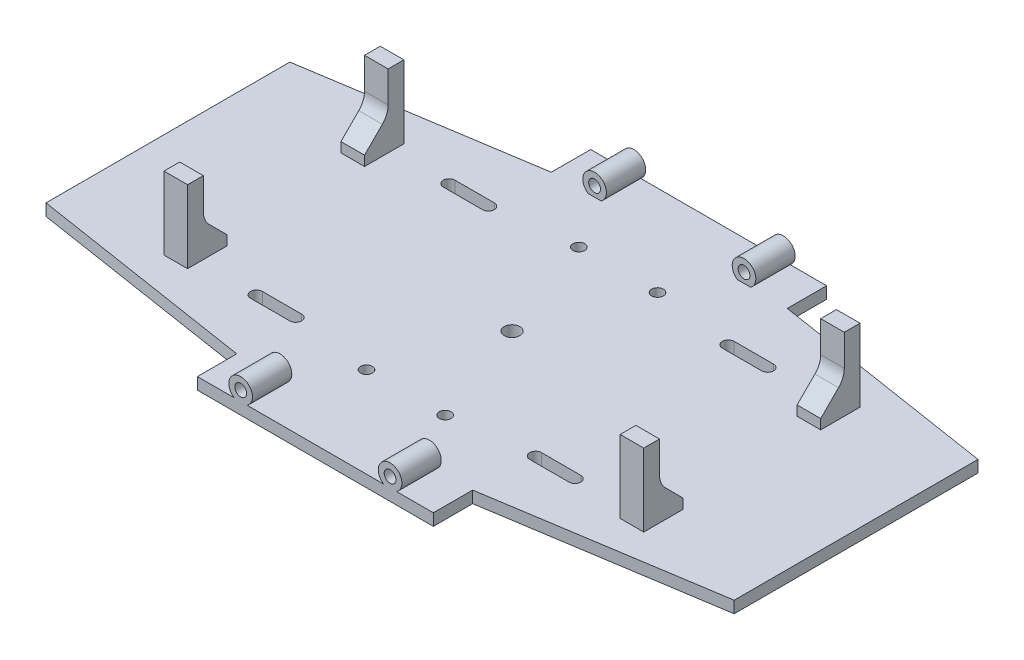
from build123d import *

# Parameters (mm, degrees)
BOSS_EXTRUDE1_DEPTH = 3
SKETCH2_R           = 3
SKETCH2_R_2         = 1.5
BOSS_EXTRUDE2_DEPTH = 10
SKETCH3_R           = 2
SKETCH3_R_2         = 1.5
CUT_EXTRUDE1_DEPTH  = 101.928192295
SKETCH4_W           = 6
SKETCH4_H           = 10
BOSS_EXTRUDE3_DEPTH = 18.5
SKETCH5_W           = 6
SKETCH5_H           = 10
CUT_EXTRUDE2_DEPTH  = 159.159729388
CHAMFER1_SIZE       = 6
FILLET1_START       = -61
FILLET1_DEPTH       = 6
FILLET1_START_2     = 55
FILLET1_2_DEPTH     = 6


with BuildPart() as part:
    # Sketch1 → Boss-Extrude1 (new body)
    with BuildSketch(Plane(origin=(0, 0, 0), x_dir=(1, 0, 0), z_dir=(0, 1, 0))):
        Polygon((30, -50), (30, -40), (30, 40), (30, 50), (-30, 50), (-30, 40), (-30, -40), (-30, -50), align=None)
        Polygon((-87.5, -31), (-30, -40), (-30, 40), (-87.5, 31), align=None)
        Polygon((30, 40), (30, -40), (87.5, -31), (87.5, 31), align=None)
    extrude(amount=BOSS_EXTRUDE1_DEPTH)

    # Sketch2 → Boss-Extrude2 (add)
    # profile 1 of 2: a face of its own
    with BuildSketch(Plane.XY.offset(50)):
        with Locations((19, 5.5)):
            Circle(SKETCH2_R)
        with Locations((19, 5.5)):
            Circle(SKETCH2_R_2, mode=Mode.SUBTRACT)
    # profile 2 of 2: a face of its own
    with BuildSketch(Plane.XY.offset(50)):
        with Locations((-19, 5.5)):
            Circle(SKETCH2_R)
        with Locations(Location((-19, 5.5, 0), (0, 0, 180))):
            Circle(SKETCH2_R_2, mode=Mode.SUBTRACT)
    boss_extrude2 = extrude(amount=-BOSS_EXTRUDE2_DEPTH)

    # Mirror1: Boss-Extrude2 across plane
    add(boss_extrude2.mirror(Plane.XY))

    # Sketch3 → Cut-Extrude1 (cut, through all)
    with BuildSketch(Plane(origin=(0, 3, 0), x_dir=(1, 0, 0), z_dir=(0, 1, 0))):
        with Locations(Location((0, 0, 0), (0, 0, 270))):
            Circle(SKETCH3_R)
        with Locations(Location((10, 27, 0), (0, 0, 270))):
            Circle(SKETCH3_R_2)
        with Locations(Location((-10, 27, 0), (0, 0, 90))):
            Circle(SKETCH3_R_2)
        with Locations(Location((10, -27, 0), (0, 0, 90))):
            Circle(SKETCH3_R_2)
        with Locations(Location((-10, -27, 0), (0, 0, 270))):
            Circle(SKETCH3_R_2)
        with BuildLine():
            Line((30.5, 26), (40.5, 26))
            ThreePointArc((40.5, 26), (42, 24.5), (40.5, 23))
            Line((40.5, 23), (30.5, 23))
            ThreePointArc((30.5, 23), (29, 24.5), (30.5, 26))
        make_face()
        with BuildLine():
            Line((-30.5, 26), (-40.5, 26))
            ThreePointArc((-40.5, 26), (-42, 24.5), (-40.5, 23))
            Line((-40.5, 23), (-30.5, 23))
            ThreePointArc((-30.5, 23), (-29, 24.5), (-30.5, 26))
        make_face()
        with BuildLine():
            Line((30.5, -26), (40.5, -26))
            ThreePointArc((40.5, -26), (42, -24.5), (40.5, -23))
            Line((40.5, -23), (30.5, -23))
            ThreePointArc((30.5, -23), (29, -24.5), (30.5, -26))
        make_face()
        with BuildLine():
            Line((-30.5, -26), (-40.5, -26))
            ThreePointArc((-40.5, -26), (-42, -24.5), (-40.5, -23))
            Line((-40.5, -23), (-30.5, -23))
            ThreePointArc((-30.5, -23), (-29, -24.5), (-30.5, -26))
        make_face()
    extrude(amount=-CUT_EXTRUDE1_DEPTH, mode=Mode.SUBTRACT)

    # Sketch4 → Boss-Extrude3 (add)
    with BuildSketch(Plane(origin=(0, 3, 0), x_dir=(1, 0, 0), z_dir=(0, 1, 0))):
        with Locations((58, 22.5)):
            Rectangle(SKETCH4_W, SKETCH4_H)
        with Locations((58, -22.5)):
            Rectangle(SKETCH4_W, SKETCH4_H)
        with Locations((-58, -22.5)):
            Rectangle(SKETCH4_W, SKETCH4_H)
        with Locations((-58, 22.5)):
            Rectangle(SKETCH4_W, SKETCH4_H)
    extrude(amount=BOSS_EXTRUDE3_DEPTH)

    # Sketch5 → Cut-Extrude2 (cut, through all)
    with BuildSketch(Plane.ZY.offset(61)):
        with Locations((-20.5, 16.5)):
            Rectangle(SKETCH5_W, SKETCH5_H)
        with Locations((20.5, 16.5)):
            Rectangle(SKETCH5_W, SKETCH5_H)
    extrude(amount=-CUT_EXTRUDE2_DEPTH, mode=Mode.SUBTRACT)

    # Chamfer1
    chamfer1_edges = [part.edges().sort_by_distance(p)[0] for p in [
        (58, 11.5, 17.5),
        (-58, 11.5, 17.5),
        (58, 11.5, -17.5),
        (-58, 11.5, -17.5),
    ]]
    chamfer(chamfer1_edges, length=CHAMFER1_SIZE - 0.0001)  # a hair under: the kernel refuses the full size

    # Fillet1: read off the stored shape, not the designer's step
    # Fillet1 outline → Fillet1 (add)
    with BuildSketch(Plane.YZ.offset(FILLET1_START)):
        with BuildLine():
            ThreePointArc((13.571067812, -23.5), (11.65765065, -23.119397663), (10.035533906, -22.035533906))
            Line((10.035533906, -22.035533906), (11.5, -23.5))
            Line((11.5, -23.5), (13.571067812, -23.5))
        make_face()
        with BuildLine():
            ThreePointArc((10.035533906, 22.035533906), (11.65765065, 23.119397663), (13.571067812, 23.5))
            Line((13.571067812, 23.5), (11.5, 23.5))
            Line((11.5, 23.5), (10.035533906, 22.035533906))
        make_face()
    extrude(amount=FILLET1_DEPTH)

    # Fillet1 2 outline → Fillet1 2 (add)
    with BuildSketch(Plane.YZ.offset(FILLET1_START_2)):
        with BuildLine():
            ThreePointArc((13.571067812, -23.5), (11.65765065, -23.119397663), (10.035533906, -22.035533906))
            Line((10.035533906, -22.035533906), (11.5, -23.5))
            Line((11.5, -23.5), (13.571067812, -23.5))
        make_face()
        with BuildLine():
            ThreePointArc((10.035533906, 22.035533906), (11.65765065, 23.119397663), (13.571067812, 23.5))
            Line((13.571067812, 23.5), (11.5, 23.5))
            Line((11.5, 23.5), (10.035533906, 22.035533906))
        make_face()
    extrude(amount=FILLET1_2_DEPTH)


solid = part.part
